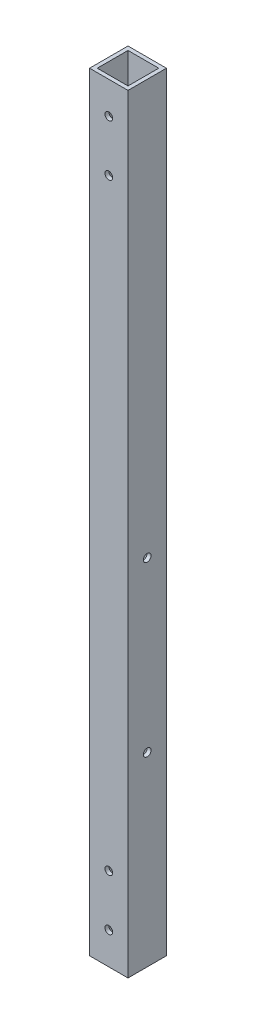
from build123d import *

# Parameters (mm, degrees)
SKETCH1_W              = 15
SKETCH1_H              = 15
SKETCH1_W_2            = 12
SKETCH1_H_2            = 12
EXTRUDE_THIN1_DEPTH    = 300
SKETCH2_R              = 1.5
CUT_EXTRUDE1_DEPTH     = 301.749064836
CUT_EXTRUDE2_OUTLINE_R = 1.5
CUT_EXTRUDE2_DEPTH     = 15


# Read off the part's stored shape, not the designer's step: Cut-Extrude2
with BuildPart() as part:
    # Sketch1 → Extrude-Thin1 (new body)
    with BuildSketch(Plane(origin=(0, 0, 0), x_dir=(1, 0, 0), z_dir=(0, 1, 0))):
        with Locations((7.5, 7.5)):
            Rectangle(SKETCH1_W, SKETCH1_H)
        with Locations((7.5, 7.5)):
            Rectangle(SKETCH1_W_2, SKETCH1_H_2, mode=Mode.SUBTRACT)
    extrude(amount=EXTRUDE_THIN1_DEPTH)

    # Sketch2 (on Front Plane) → Cut-Extrude1 (cut, through all)
    with BuildSketch(Plane.XY):
        with Locations((7.5, 12.5)):
            Circle(SKETCH2_R)
        with Locations((7.5, 32.5)):
            Circle(SKETCH2_R)
        with Locations((7.5, 267.5)):
            Circle(SKETCH2_R)
        with Locations((7.5, 287.5)):
            Circle(SKETCH2_R)
    extrude(amount=-CUT_EXTRUDE1_DEPTH, mode=Mode.SUBTRACT)

    # Cut-Extrude2 outline → Cut-Extrude2 (cut)
    with BuildSketch(Plane.YZ):
        with Locations((138.290000004, -7.5)):
            Circle(CUT_EXTRUDE2_OUTLINE_R)
        with Locations((72.500000004, -7.5)):
            Circle(CUT_EXTRUDE2_OUTLINE_R)
    extrude(amount=CUT_EXTRUDE2_DEPTH, mode=Mode.SUBTRACT)


solid = part.part
